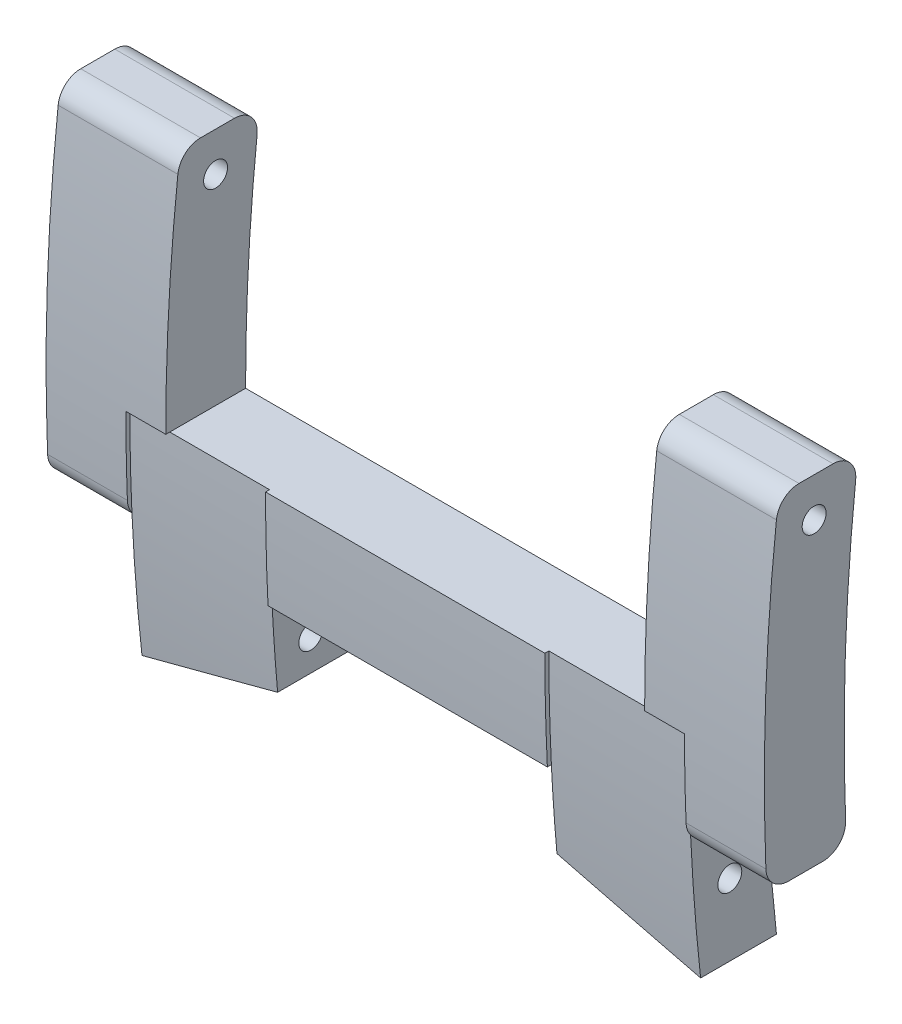
from build123d import *

# Parameters (mm, degrees)
BOSS_EXTRUDE2_DEPTH = 5
SKETCH8_R           = 50
CUT_EXTRUDE6_DEPTH  = 20
SKETCH9_OUTSIDE_W   = 10.721
SKETCH9_OUTSIDE_H   = 17.86
SKETCH9_OUTSIDE_R   = 50
CUT_EXTRUDE7_DEPTH  = 20
SKETCH11_W          = 7
SKETCH11_H          = 2.5
BOSS_EXTRUDE4_DEPTH = 2
SKETCH12_OUTSIDE_W  = 9.685
SKETCH12_OUTSIDE_H  = 17.824
SKETCH12_OUTSIDE_R  = 50
CUT_EXTRUDE8_DEPTH  = 20
SKETCH13_R          = 0.3
CUT_EXTRUDE10_DEPTH = 21.130822139
SKETCH14_R          = 0.3
CUT_EXTRUDE11_DEPTH = 20
FILLET1_R           = 0.57


with BuildPart() as part:
    # Sketch1 → Boss-Extrude2 (new body)
    with BuildSketch(Plane.XY):
        Polygon((0, 0), (0, 8.5), (3, 8.5), (3, 2.5), (15, 2.5), (15, 8.5), (18, 8.5), (18, 0), (16, 0), (16, -3), (12.5, -2), (12.5, 0), (5.5, 0), (5.5, -2), (2, -3), (2, 0), align=None)
    extrude(amount=BOSS_EXTRUDE2_DEPTH)

    # Sketch8 → Cut-Extrude6 (cut)
    with BuildSketch(Plane(origin=(0, 0, 0), x_dir=(0, 0, -1), z_dir=(1, 0, 0))):
        with Locations((49, 2.5)):
            Circle(SKETCH8_R)
    extrude(amount=CUT_EXTRUDE6_DEPTH, mode=Mode.SUBTRACT)

    # Sketch9 outside → Cut-Extrude7 (cut)
    with BuildSketch(Plane(origin=(0, 0, 0), x_dir=(0, 0, -1), z_dir=(1, 0, 0))):
        with Locations((-2.8195, 2.75)):
            Rectangle(SKETCH9_OUTSIDE_W, SKETCH9_OUTSIDE_H)
        with Locations((47.1, 2.5)):
            Circle(SKETCH9_OUTSIDE_R, mode=Mode.SUBTRACT)
    extrude(amount=CUT_EXTRUDE7_DEPTH, mode=Mode.SUBTRACT)

    # Sketch11 → Boss-Extrude4 (add)
    with BuildSketch(Plane.XY.offset(4)):
        Polygon((0, 0), (0, 8.5), (3, 8.5), (3, 2.5), (2, 2.5), (2, 0), align=None)
        with Locations((9, 1.25)):
            Rectangle(SKETCH11_W, SKETCH11_H)
        Polygon((18, 8.5), (15, 8.5), (15, 2.5), (16, 2.5), (16, 0), (18, 0), align=None)
    extrude(amount=-BOSS_EXTRUDE4_DEPTH)

    # Sketch12 outside → Cut-Extrude8 (cut)
    with BuildSketch(Plane(origin=(0, 0, 0), x_dir=(0, 0, -1), z_dir=(1, 0, 0))):
        with Locations((-2.3195, 2.75)):
            Rectangle(SKETCH12_OUTSIDE_W, SKETCH12_OUTSIDE_H)
        with Locations((47, 2.5)):
            Circle(SKETCH12_OUTSIDE_R, mode=Mode.SUBTRACT)
    extrude(amount=CUT_EXTRUDE8_DEPTH, mode=Mode.SUBTRACT)

    # Sketch13 → Cut-Extrude10 (cut, through all)
    with BuildSketch(Plane(origin=(0, 0, 0), x_dir=(0, 0, -1), z_dir=(1, 0, 0))):
        with Locations(Location((-1.752335907, 7.52, 0), (0, 0, 270))):
            Circle(SKETCH13_R)
    extrude(amount=CUT_EXTRUDE10_DEPTH, mode=Mode.SUBTRACT)

    # Sketch14 → Cut-Extrude11 (cut)
    with BuildSketch(Plane(origin=(0, 0, 0), x_dir=(0, 0, -1), z_dir=(1, 0, 0))):
        with Locations(Location((-1.865607241, -1.2, 0), (0, 0, 270))):
            Circle(SKETCH14_R)
    extrude(amount=CUT_EXTRUDE11_DEPTH, mode=Mode.SUBTRACT)

    # Fillet1
    # the kernel refuses this fillet: 0.57 mm, written as the material it takes off along each edge
    with BuildSketch(Plane(origin=(4.276921505, 8.5, 2.638694584), x_dir=(0, 0, -1), z_dir=(-1, 0, 0)), Plane(origin=(19.276921505, 8.5, 2.638694584), x_dir=(0, 0, -1), z_dir=(-1, 0, 0))) as fillet1_piece_1:
        with BuildLine():
            CenterArc((0.507848876, 0.57), FILLET1_R, 186.30680233, 83.69319767)
            ThreePointArc((-0.058701439, 0.50738418), (-0.029998613, 0.253617132), (0, 0))
            Line((0, 0), (0.507848876, 0))
        make_face()
    extrude(amount=5.553843009, mode=Mode.SUBTRACT)
    with BuildSketch(Plane(origin=(2, 0, 2.937460889), x_dir=(0, 0.9990083494707687, 0.0445232263845563), z_dir=(-1, 0, 0))) as fillet1_piece_2:
        with BuildLine():
            CenterArc((0.545162753, 0.569991432), FILLET1_R, 182.551836528, 87.762310927)
            Line((-0.024272006, 0.544613193), (0, 0))
            ThreePointArc((0, 0), (0.274143997, -0.000751555), (0.548287995, 0))
        make_face()
    extrude(amount=3.370719987, mode=Mode.SUBTRACT)
    with BuildSketch(Plane(origin=(19.370719987, 0, 2.937460889), x_dir=(0, 0, -1), z_dir=(-1, 0, 0))) as fillet1_piece_3:
        with BuildLine():
            CenterArc((0.545153795, -0.57), FILLET1_R, 90, 87.762310927)
            ThreePointArc((-0.024411551, -0.547744285), (-0.012956585, -0.273838681), (0, 0))
            Line((0, 0), (0.545153795, 0))
        make_face()
    extrude(amount=3.370719987, mode=Mode.SUBTRACT)
    with BuildSketch(Plane(origin=(2, 0, 0.937460889), x_dir=(0, 0.9990278617443559, 0.04408323330360469), z_dir=(-1, 0, 0)), Plane(origin=(19.489241357, 0, 0.937460889), x_dir=(0, 0.9990278617443559, 0.04408323330360409), z_dir=(-1, 0, 0))) as fillet1_piece_4:
        with BuildLine():
            CenterArc((0.595706111, -0.569990001), FILLET1_R, 90.339381978, 92.187220026)
            Line((0.02626023, -0.595117444), (0, 0))
            ThreePointArc((0, 0), (0.296164915, -0.000877144), (0.592329831, 0))
        make_face()
    extrude(amount=3.489241357, mode=Mode.SUBTRACT)
    with BuildSketch(Plane(origin=(4.59733659, 8.5, 0.638694584), x_dir=(0, 0, 1), z_dir=(-1, 0, 0))) as fillet1_piece_5:
        with BuildLine():
            CenterArc((0.638934636, -0.57), FILLET1_R, 90, 96.164070516)
            ThreePointArc((0.072230095, -0.631204271), (0.037117605, -0.315487411), (0, 0))
            Line((0, 0), (0.638934636, 0))
        make_face()
    extrude(amount=6.194673181, mode=Mode.SUBTRACT)
    with BuildSketch(Plane(origin=(19.59733659, 8.5, 0.638694584), x_dir=(0, -0.993516243777255, 0.1136902517841086), z_dir=(-1, 0, 0))) as fillet1_piece_6:
        with BuildLine():
            CenterArc((0.638944899, 0.569988496), FILLET1_R, 173.471913452, 96.164070516)
            Line((0.07264064, 0.63479194), (0, 0))
            ThreePointArc((0, 0), (0.317661777, 0.0010091), (0.635323554, 0))
        make_face()
    extrude(amount=6.194673181, mode=Mode.SUBTRACT)


solid = part.part
